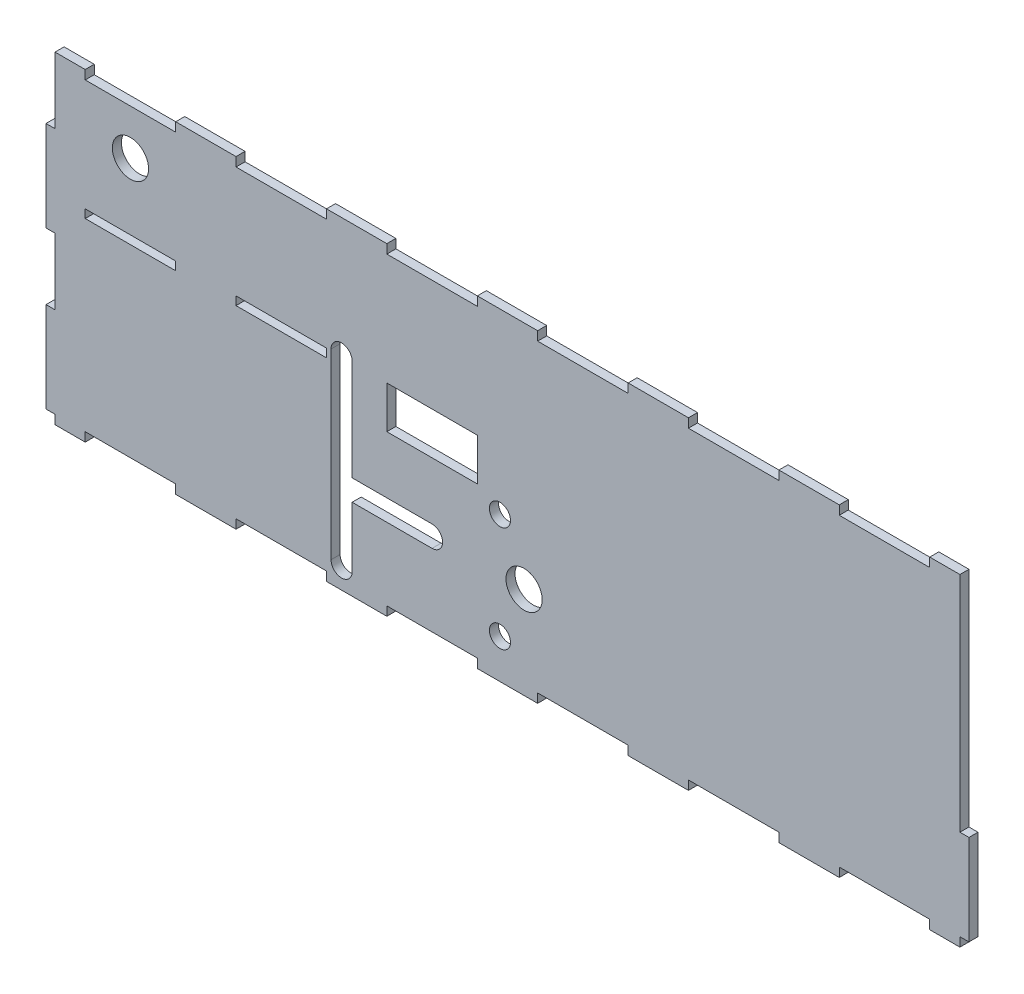
from build123d import *

# Parameters (mm, degrees)
IMPORTED_START                = -3
IMPORTED_BODY_4_1_OUTLINE_W   = 30
IMPORTED_BODY_4_1_OUTLINE_H   = 2.8
IMPORTED_BODY_4_1_OUTLINE_H_2 = 14
IMPORTED_BODY_4_1_DEPTH       = 3
SKETCH_1_R                    = 3.5
SKETCH_1_R_2                  = 6
CUT_EXTRUDE_1_DEPTH           = 3


# Read off the part's stored shape, not the designer's step: 基体零件-零件4-1
with BuildPart() as part:
    # 基体零件-零件4-1 outline → 基体零件-零件4-1 (new body)
    with BuildSketch(Plane.XY.offset(IMPORTED_START)):
        Polygon((0, 0), (0, -3), (10, -3), (10, 0), (40, 0), (40, -3), (60, -3), (60, 0), (90, 0), (90, -3), (110, -3), (110, 0), (140, 0), (140, -3), (160, -3), (160, 0), (190, 0), (190, -3), (210, -3), (210, 0), (240, 0), (240, -3), (260, -3), (260, 0), (290, 0), (290, -3), (300.000000004, -3), (300.000000004, 0), (303.000000004, 0), (303.000000004, 30), (300.000000004, 30), (300.000000004, 104), (290, 104), (290, 100.999999998), (260, 100.999999998), (260, 103.999999998), (240, 103.999999998), (240, 100.999999998), (210, 100.999999998), (210, 103.999999998), (190, 103.999999998), (190, 100.999999998), (160, 100.999999998), (160, 103.999999998), (140, 103.999999998), (140, 100.999999998), (110, 100.999999998), (110, 103.999999998), (90, 103.999999998), (90, 100.999999998), (60, 100.999999998), (60, 103.999999998), (40, 103.999999998), (40, 100.999999998), (10, 100.999999998), (10, 103.999999998), (0, 103.999999998), (0, 81.999999998), (-3, 81.999999998), (-3, 51.999999998), (0, 51.999999998), (0, 30), (-3, 30), (-3, 0), align=None)
        with Locations((25, 62.6)):
            Rectangle(IMPORTED_BODY_4_1_OUTLINE_W, IMPORTED_BODY_4_1_OUTLINE_H, mode=Mode.SUBTRACT)
        with Locations((75, 62.6)):
            Rectangle(IMPORTED_BODY_4_1_OUTLINE_W, IMPORTED_BODY_4_1_OUTLINE_H, mode=Mode.SUBTRACT)
        with Locations((125, 57)):
            Rectangle(IMPORTED_BODY_4_1_OUTLINE_W, IMPORTED_BODY_4_1_OUTLINE_H_2, mode=Mode.SUBTRACT)
    extrude(amount=IMPORTED_BODY_4_1_DEPTH)

    # 草图1 → 切除-拉伸1 (cut)
    with BuildSketch(Plane(origin=(0, 0, -3), x_dir=(-1, 0, 0), z_dir=(0, 0, -1))):
        with Locations(Location((-147.5, 10, 0), (0, 0, 180))):
            Circle(SKETCH_1_R)
        with Locations(Location((-147.5, 45, 0), (0, 0, 180))):
            Circle(SKETCH_1_R)
        with Locations(Location((-155.5, 27.5, 0), (0, 0, 180))):
            Circle(SKETCH_1_R_2)
        with Locations((-25, 85.991178075)):
            Circle(SKETCH_1_R_2)
        with BuildLine():
            Line((-125, 31), (-98.5, 31))
            Line((-98.5, 31), (-98.5, 64.5))
            ThreePointArc((-98.5, 64.5), (-95, 68), (-91.5, 64.5))
            Line((-91.5, 64.5), (-91.5, 4))
            ThreePointArc((-91.5, 4), (-95, 0.5), (-98.5, 4))
            Line((-98.5, 4), (-98.5, 24))
            Line((-98.5, 24), (-125, 24))
            ThreePointArc((-125, 24), (-128.5, 27.5), (-125, 31))
        make_face()
    extrude(amount=-CUT_EXTRUDE_1_DEPTH, mode=Mode.SUBTRACT)


solid = part.part
